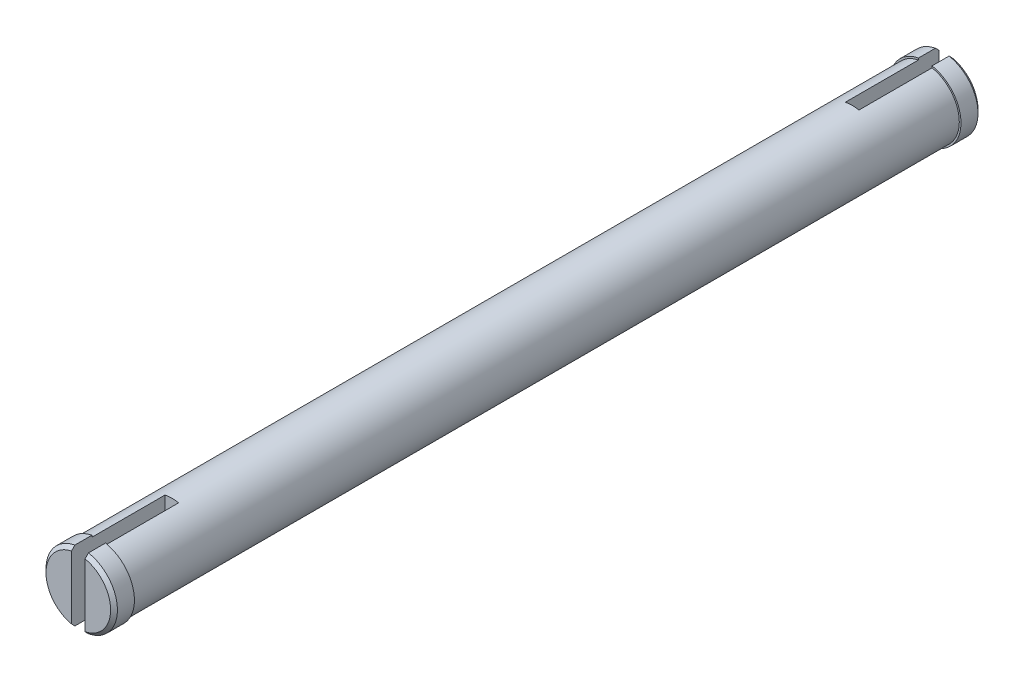
from build123d import *

# Parameters (mm, degrees)
SKETCH_1_R          = 2
EXTRUDE_1_DEPTH     = 25.5
SKETCH_2_R          = 2.1
EXTRUDE_2_DEPTH     = 1.2
CHAMFER_1_SIZE      = 0.2
SKETCH_3_W          = 0.8
SKETCH_3_H          = 4.5
CUT_EXTRUDE_1_DEPTH = 5.5


# Read off the part's stored shape, not the designer's step: 镜向1
with BuildPart() as part:
    # 草图1 → 凸台-拉伸1 (new body)
    with BuildSketch(Plane.XY):
        Circle(SKETCH_1_R)
    extrude(amount=EXTRUDE_1_DEPTH)

    # 草图2 → 凸台-拉伸2 (add)
    with BuildSketch(Plane.XY.offset(25.5)):
        Circle(SKETCH_2_R)
    extrude(amount=-EXTRUDE_2_DEPTH)

    # 倒角1
    chamfer_1_edges = [part.edges().sort_by_distance(p)[0] for p in [
        (-2.1, 0, 25.5),
    ]]
    chamfer(chamfer_1_edges, length=CHAMFER_1_SIZE)

    # 草图3 → 切除-拉伸1 (cut)
    with BuildSketch(Plane.XY.offset(25.5)):
        Rectangle(SKETCH_3_W, SKETCH_3_H)
    extrude(amount=-CUT_EXTRUDE_1_DEPTH, mode=Mode.SUBTRACT)

    # 镜向1: part across plane


with BuildPart() as part_1:
    add(part.part)
    add(part.part.mirror(Plane.XY))


solid = part_1.part
